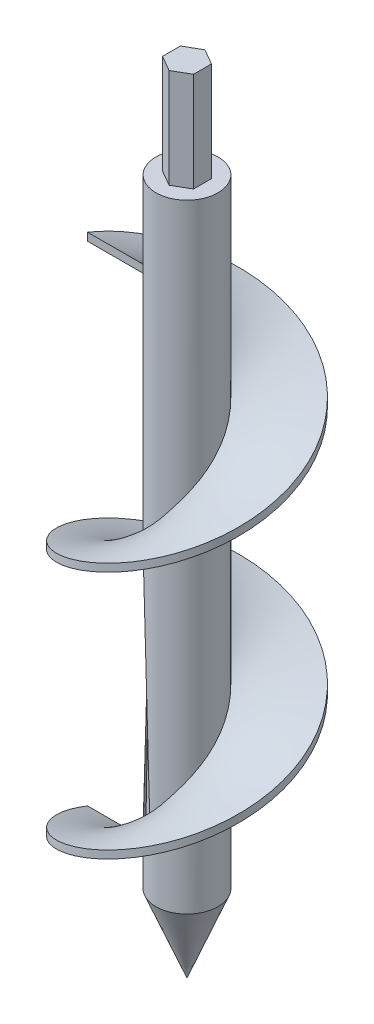
from build123d import *

# Parameters (mm, degrees)
BOSS_EXTRUDE1_DEPTH = 25.4
SWEEP1_PITCH        = 63.5


with BuildPart() as part:
    # Sketch1 → Revolve1 (revolve)
    with BuildSketch(Plane.XY, mode=Mode.PRIVATE) as revolve1_sk:
        Polygon((0, 0), (7.9375, 0), (7.9375, -158.044444444), (0, -177.8), align=None)
    revolve(revolve1_sk.sketch.rotate(Axis((0, -177.8, 0), (0, 1, 0)), 90), axis=Axis((0, -177.8, 0), (0, 1, 0)))

    # Sketch2 → Boss-Extrude1 (add)
    with BuildSketch(Plane(origin=(0, 0, 0), x_dir=(1, 0, 0), z_dir=(0, 1, 0))):
        Polygon((0, -4.582717762), (3.96875, -2.291358881), (3.96875, 2.291358881), (0, 4.582717762), (-3.96875, 2.291358881), (-3.96875, -2.291358881), align=None)
    extrude(amount=BOSS_EXTRUDE1_DEPTH)

    # Sweep1: the profile of Sketch4 profile screwed along a right-hand helix of 2 turns, 30 arcs to a turn; built about Z, then put on its axis
    sweep1_z = Axis((0, 0, 0), (0, 0, 1))
    sweep1_corners = [(7.9372, 0, 0), (25.4, 0, 0), (25.4, 0, 2), (7.9372, 0, 2)]
    with BuildLine(mode=Mode.PRIVATE) as sweep1_profile:
        Line(sweep1_corners[0], sweep1_corners[1])
        Line(sweep1_corners[1], sweep1_corners[2])
        Line(sweep1_corners[2], sweep1_corners[3])
        Line(sweep1_corners[3], sweep1_corners[0])
    sweep1_cap = Face(sweep1_profile.wire())
    sweep1_turn_angles = [0, 6, 12, 18, 24, 30, 36, 42, 48, 54, 60, 66, 72, 78, 84, 90, 96, 102, 108, 114, 120, 126, 132, 138, 144, 150, 156, 162, 168, 174, 180, 186, 192, 198, 204, 210, 216, 222, 228, 234, 240, 246, 252, 258, 264, 270, 276, 282, 288, 294, 300, 306, 312, 318, 324, 330, 336, 342, 348, 354, 360]
    sweep1_turn_weights = [1, 0.9945218953682733, 1, 0.9945218953682733, 1, 0.9945218953682733, 1, 0.9945218953682733, 1, 0.9945218953682733, 1, 0.9945218953682733, 1, 0.9945218953682733, 1, 0.9945218953682733, 1, 0.9945218953682733, 1, 0.9945218953682733, 1, 0.9945218953682733, 1, 0.9945218953682733, 1, 0.9945218953682733, 1, 0.9945218953682733, 1, 0.9945218953682733, 1, 0.9945218953682733, 1, 0.9945218953682733, 1, 0.9945218953682733, 1, 0.9945218953682733, 1, 0.9945218953682733, 1, 0.9945218953682733, 1, 0.9945218953682733, 1, 0.9945218953682733, 1, 0.9945218953682733, 1, 0.9945218953682733, 1, 0.9945218953682733, 1, 0.9945218953682733, 1, 0.9945218953682733, 1, 0.9945218953682733, 1, 0.9945218953682733, 1]
    sweep1_turn_rails = [Edge.make_bspline([Vector(p[0], p[1], 0).rotate(sweep1_z, sweep1_turn_angles[k]) / sweep1_turn_weights[k] + Vector(0, 0, p[2] + SWEEP1_PITCH * sweep1_turn_angles[k] / 360) for k in range(61)], [0, 0, 0, 1, 1, 2, 2, 3, 3, 4, 4, 5, 5, 6, 6, 7, 7, 8, 8, 9, 9, 10, 10, 11, 11, 12, 12, 13, 13, 14, 14, 15, 15, 16, 16, 17, 17, 18, 18, 19, 19, 20, 20, 21, 21, 22, 22, 23, 23, 24, 24, 25, 25, 26, 26, 27, 27, 28, 28, 29, 29, 30, 30, 30], 2, sweep1_turn_weights) for p in sweep1_corners]
    sweep1_turn_sides = [Face.make_surface_from_curves(sweep1_turn_rails[p[0]], sweep1_turn_rails[p[1]]) for p in [(0, 1), (1, 2), (2, 3), (3, 0)]]
    sweep1 = Plane(origin=(0, -25.4, 0), x_dir=(-1, 0, 0), z_dir=(0, -1, 0)) * Solid(Shell([*[p.moved(Location((0, 0, SWEEP1_PITCH * i))) for i in range(2) for p in sweep1_turn_sides], sweep1_cap, sweep1_cap.rotate(sweep1_z, 720).moved(Location((0, 0, SWEEP1_PITCH * 720 / 360)))]))
    add(sweep1)


solid = part.part
